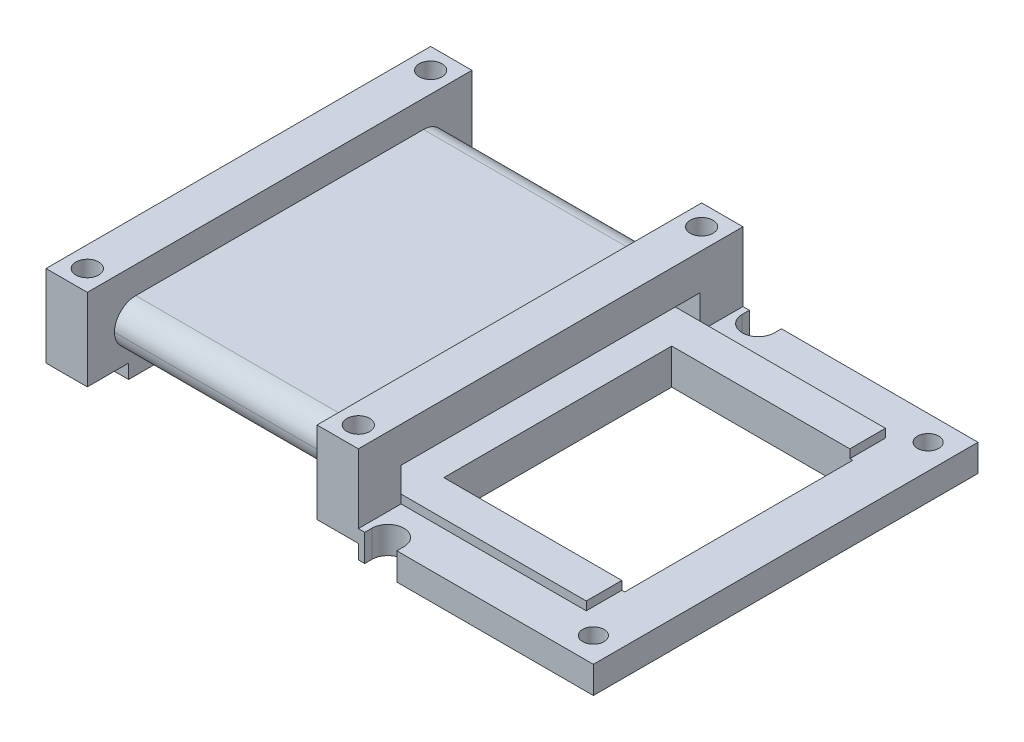
from build123d import *

# Parameters (mm, degrees)
SKETCH1_W           = 46.4
SKETCH1_H           = 5.9
SKETCH1_W_2         = 42
SKETCH1_H_2         = 3.5
BOSS_EXTRUDE1_DEPTH = 32.25
FILLET2_R           = 3
SKETCH2_W           = 54
SKETCH2_H           = 13.5
SKETCH2_W_2         = 42
SKETCH2_H_2         = 3.5
BOSS_EXTRUDE2_DEPTH = 5.8
SKETCH3_W           = 54
SKETCH3_H           = 13.5
SKETCH3_W_2         = 42
SKETCH3_H_2         = 3.5
BOSS_EXTRUDE3_DEPTH = 5.8
SKETCH4_R           = 1.6
CUT_EXTRUDE1_DEPTH  = 65.421211569
SKETCH15_W          = 42
SKETCH15_H          = 3.5
SKETCH15_W_2        = 5.8
SKETCH15_H_2        = 2
CUT_EXTRUDE5_DEPTH  = 68.356903878
FILLET3_R           = 2
SKETCH16_W          = 42
SKETCH16_H          = 1.2
BOSS_EXTRUDE4_DEPTH = 26
SKETCH16_3_W        = 5.8
SKETCH16_3_H        = 2
BOSS_EXTRUDE5_DEPTH = 30
SKETCH17_W          = 29
SKETCH17_H          = 32
CUT_EXTRUDE6_DEPTH  = 10
CUT_EXTRUDE7_DEPTH  = 30
SKETCH19_W          = 3.6
SKETCH19_H          = 32
BOSS_EXTRUDE6_DEPTH = 3.8
SKETCH20_R          = 1.5
CUT_EXTRUDE8_DEPTH  = 88.534179039


with BuildPart() as part:
    # Sketch1 → Boss-Extrude1 (new body)
    with BuildSketch(Plane(origin=(0, 0, 0), x_dir=(0, 0, -1), z_dir=(1, 0, 0))):
        with Locations((23.2, 2.95)):
            Rectangle(SKETCH1_W, SKETCH1_H)
        with Locations((23.2, 2.95)):
            Rectangle(SKETCH1_W_2, SKETCH1_H_2, mode=Mode.SUBTRACT)
    extrude(amount=BOSS_EXTRUDE1_DEPTH)

    # Fillet2
    # the kernel refuses this fillet: 3 mm, written as the material it takes off along each edge
    with BuildSketch(Plane(origin=(-7.5, 0, -46.4), x_dir=(0, 0, 1), z_dir=(1, 0, 0)), Plane(origin=(-7.5, 5.9, 0), x_dir=(0, 0, -1), z_dir=(1, 0, 0)), Plane(origin=(-7.5, 5.9, -46.4), x_dir=(0, -1, 0), z_dir=(1, 0, 0))) as fillet2_piece_1:
        with BuildLine():
            CenterArc((FILLET2_R, -FILLET2_R), FILLET2_R, 90, 90)
            Line((0, -FILLET2_R), (0, 0))
            Line((0, 0), (FILLET2_R, 0))
        make_face()
    extrude(amount=47.25, mode=Mode.SUBTRACT)
    with BuildSketch(Plane(origin=(-7.5, 0, 0), x_dir=(0, 0, -1), z_dir=(1, 0, 0))) as fillet2_piece_2:
        with BuildLine():
            CenterArc((FILLET2_R, FILLET2_R), FILLET2_R, 180, 90)
            Line((0, FILLET2_R), (0, 0))
            Line((0, 0), (FILLET2_R, 0))
        make_face()
    extrude(amount=47.25, mode=Mode.SUBTRACT)

    # Sketch2 → Boss-Extrude2 (add)
    with BuildSketch(Plane(origin=(32.25, 0, 0), x_dir=(0, 0, -1), z_dir=(1, 0, 0))):
        with Locations((23.2, 2.95)):
            Rectangle(SKETCH2_W, SKETCH2_H)
        with Locations((23.2, 2.95)):
            Rectangle(SKETCH2_W_2, SKETCH2_H_2, mode=Mode.SUBTRACT)
    extrude(amount=BOSS_EXTRUDE2_DEPTH)

    # Sketch3 → Boss-Extrude3 (add)
    with BuildSketch(Plane.ZY):
        with Locations((-23.2, 2.95)):
            Rectangle(SKETCH3_W, SKETCH3_H)
        with Locations((-23.2, 2.95)):
            Rectangle(SKETCH3_W_2, SKETCH3_H_2, mode=Mode.SUBTRACT)
    extrude(amount=BOSS_EXTRUDE3_DEPTH)

    # Sketch4 → Cut-Extrude1 (cut, through all)
    with BuildSketch(Plane(origin=(0, 9.7, 0), x_dir=(1, 0, 0), z_dir=(0, 1, 0))):
        with Locations(Location((-2.9, 47.3, 0), (0, 0, 270))):
            Circle(SKETCH4_R)
        with Locations(Location((35.15, 47.3, 0), (0, 0, 270))):
            Circle(SKETCH4_R)
        with Locations(Location((-2.9, -0.9, 0), (0, 0, 270))):
            Circle(SKETCH4_R)
        with Locations(Location((35.15, -0.9, 0), (0, 0, 270))):
            Circle(SKETCH4_R)
    extrude(amount=-CUT_EXTRUDE1_DEPTH, mode=Mode.SUBTRACT)

    # Sketch15 → Cut-Extrude5 (cut, through all)
    with BuildSketch(Plane.ZY.offset(5.8)):
        with Locations((-23.2, 2.95)):
            Rectangle(SKETCH15_W, SKETCH15_H)
        with Locations((-47.3, -2.8)):
            Rectangle(SKETCH15_W_2, SKETCH15_H_2)
        with Locations((0.9, -2.8)):
            Rectangle(SKETCH15_W_2, SKETCH15_H_2)
    extrude(amount=-CUT_EXTRUDE5_DEPTH, mode=Mode.SUBTRACT)

    # Fillet3
    fillet3_edges = [part.edges().sort_by_distance(p)[0] for p in [
        (-5.8, -3.8, -23.2),
    ]]
    fillet(fillet3_edges, radius=FILLET3_R)

    # Sketch16 → Boss-Extrude4 (add)
    with BuildSketch(Plane(origin=(38.05, 0, 0), x_dir=(0, 0, -1), z_dir=(1, 0, 0))):
        with Locations((23.2, 0.6)):
            Rectangle(SKETCH16_W, SKETCH16_H)
    extrude(amount=BOSS_EXTRUDE4_DEPTH)

    # Sketch16<3> → Boss-Extrude5 (add)
    with BuildSketch(Plane(origin=(38.05, 0, 0), x_dir=(0, 0, -1), z_dir=(1, 0, 0))):
        Polygon((2, -1.8), (2, -3.8), (44.4, -3.8), (44.4, -1.8), (50.2, -1.8), (50.2, 0), (44.2, 0), (2.2, 0), (-3.8, 0), (-3.8, -1.8), align=None)
        with Locations((-0.9, -2.8)):
            Rectangle(SKETCH16_3_W, SKETCH16_3_H)
        with Locations((47.3, -2.8)):
            Rectangle(SKETCH16_3_W, SKETCH16_3_H)
    extrude(amount=BOSS_EXTRUDE5_DEPTH)

    # Sketch17 → Cut-Extrude6 (cut)
    with BuildSketch(Plane(origin=(0, 1.2, 0), x_dir=(1, 0, 0), z_dir=(0, 1, 0))):
        with Locations((53.55, 23.2)):
            Rectangle(SKETCH17_W, SKETCH17_H)
    extrude(amount=-CUT_EXTRUDE6_DEPTH, mode=Mode.SUBTRACT)

    # Sketch18 → Cut-Extrude7 (cut)
    with BuildSketch(Plane.XZ.offset(3.8)):
        with BuildLine():
            ThreePointArc((39.184435563, 3.8), (39.00939278, 3.313556237), (38.95, 2.8))
            ThreePointArc((38.95, 2.8), (41.2, 0.55), (43.45, 2.8))
            ThreePointArc((43.45, 2.8), (43.39060722, 3.313556237), (43.215564437, 3.8))
            Line((43.215564437, 3.8), (39.184435563, 3.8))
        make_face()
        with BuildLine():
            ThreePointArc((43.215564437, 3.8), (41.2, 5.05), (39.184435563, 3.8))
            Line((39.184435563, 3.8), (43.215564437, 3.8))
        make_face()
        with BuildLine():
            Line((38.95, 3.8), (38.95, 2.8))
            ThreePointArc((38.95, 2.8), (39.00939278, 3.313556237), (39.184435563, 3.8))
            Line((39.184435563, 3.8), (38.95, 3.8))
        make_face()
        with BuildLine():
            ThreePointArc((43.215564437, 3.8), (43.39060722, 3.313556237), (43.45, 2.8))
            Line((43.45, 2.8), (43.45, 3.8))
            Line((43.45, 3.8), (43.215564437, 3.8))
        make_face()
        with BuildLine():
            ThreePointArc((43.45, -49.2), (41.2, -46.95), (38.95, -49.2))
            ThreePointArc((38.95, -49.2), (39.00939278, -49.713556237), (39.184435563, -50.2))
            Line((39.184435563, -50.2), (43.215564437, -50.2))
            ThreePointArc((43.215564437, -50.2), (43.39060722, -49.713556237), (43.45, -49.2))
        make_face()
        with BuildLine():
            Line((43.215564437, -50.2), (39.184435563, -50.2))
            ThreePointArc((39.184435563, -50.2), (41.2, -51.45), (43.215564437, -50.2))
        make_face()
        with BuildLine():
            ThreePointArc((39.184435563, -50.2), (39.00939278, -49.713556237), (38.95, -49.2))
            Line((38.95, -49.2), (38.95, -50.2))
            Line((38.95, -50.2), (39.184435563, -50.2))
        make_face()
        with BuildLine():
            Line((43.45, -50.2), (43.45, -49.2))
            ThreePointArc((43.45, -49.2), (43.39060722, -49.713556237), (43.215564437, -50.2))
            Line((43.215564437, -50.2), (43.45, -50.2))
        make_face()
    extrude(amount=-CUT_EXTRUDE7_DEPTH, mode=Mode.SUBTRACT)

    # Sketch19 → Boss-Extrude6 (add)
    with BuildSketch(Plane.XZ.offset(3.8)):
        with Locations((66.25, -23.2)):
            Rectangle(SKETCH19_W, SKETCH19_H)
        Polygon((71.05, 3.8), (68.05, 3.8), (68.05, -7.2), (68.05, -39.2), (68.05, -50.2), (71.05, -50.2), align=None)
    extrude(amount=-BOSS_EXTRUDE6_DEPTH)

    # Sketch20 → Cut-Extrude8 (cut, through all)
    with BuildSketch(Plane(origin=(0, 0, 0), x_dir=(1, 0, 0), z_dir=(0, 1, 0))):
        with Locations(Location((67.55, -0.3, 0), (0, 0, 270))):
            Circle(SKETCH20_R)
        with Locations(Location((67.55, 46.7, 0), (0, 0, 270))):
            Circle(SKETCH20_R)
    extrude(amount=-CUT_EXTRUDE8_DEPTH, mode=Mode.SUBTRACT)


solid = part.part
